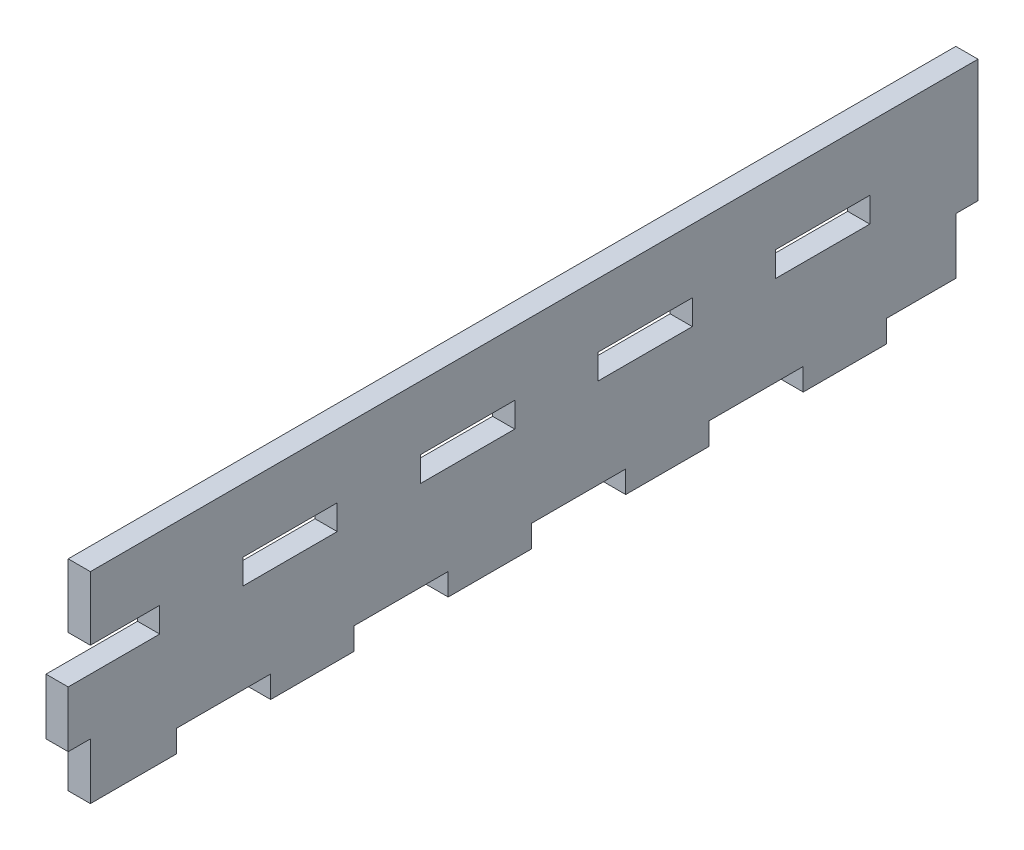
from build123d import *

# Parameters (mm, degrees)
ESQUISSE1_W             = 82
ESQUISSE1_H             = 12.11
BOSS_EXTRU_1_DEPTH      = 2
ESQUISSE2_W             = 8.5
ESQUISSE2_H             = 2.25
ENL_V_MAT_EXTRU_1_DEPTH = 42.581069992
ESQUISSE3_W             = 8.5
ESQUISSE3_H             = 2
ENL_V_MAT_EXTRU_2_DEPTH = 42.581069992
ESQUISSE4_W             = 2
ESQUISSE4_H             = 5.055
ENL_V_MAT_EXTRU_3_DEPTH = 42.581069992
ESQUISSE5_W             = 80
ESQUISSE5_H             = 6
BOSS_EXTRU_2_DEPTH      = 2
ESQUISSE6_W             = 6.25
ESQUISSE6_H             = 0.25
ESQUISSE6_W_2           = 8.5
ENL_V_MAT_EXTRU_4_DEPTH = 43.867766231


with BuildPart() as part:
    # Esquisse1 → Boss.-Extru.1 (new body)
    with BuildSketch(Plane(origin=(0, 0, 0), x_dir=(0, 0, -1), z_dir=(1, 0, 0))):
        with Locations((-0.0892, 0)):
            Rectangle(ESQUISSE1_W, ESQUISSE1_H)
    extrude(amount=BOSS_EXTRU_1_DEPTH)

    # Esquisse2 → Enlèv. mat.-Extru.1 (cut, through all)
    with BuildSketch(Plane(origin=(0, 0, 0), x_dir=(0, 0, -1), z_dir=(1, 0, 0))):
        with Locations((-37.0892, 5.18)):
            Rectangle(ESQUISSE2_W, ESQUISSE2_H)
        with Locations((-21.0892, 5.18)):
            Rectangle(ESQUISSE2_W, ESQUISSE2_H)
        with Locations((-5.0892, 5.18)):
            Rectangle(ESQUISSE2_W, ESQUISSE2_H)
        with Locations((10.9108, 5.18)):
            Rectangle(ESQUISSE2_W, ESQUISSE2_H)
        with Locations((26.9108, 5.18)):
            Rectangle(ESQUISSE2_W, ESQUISSE2_H)
    extrude(amount=ENL_V_MAT_EXTRU_1_DEPTH, mode=Mode.SUBTRACT)

    # Esquisse3 → Enlèv. mat.-Extru.2 (cut, through all)
    with BuildSketch(Plane(origin=(0, 0, 0), x_dir=(0, 0, -1), z_dir=(1, 0, 0))):
        with Locations((-27.0892, -5.055)):
            Rectangle(ESQUISSE3_W, ESQUISSE3_H)
        with Locations((-11.0892, -5.055)):
            Rectangle(ESQUISSE3_W, ESQUISSE3_H)
        with Locations((4.9108, -5.055)):
            Rectangle(ESQUISSE3_W, ESQUISSE3_H)
        with Locations((20.9108, -5.055)):
            Rectangle(ESQUISSE3_W, ESQUISSE3_H)
        with Locations((36.9108, -5.055)):
            Rectangle(ESQUISSE3_W, ESQUISSE3_H)
    extrude(amount=ENL_V_MAT_EXTRU_2_DEPTH, mode=Mode.SUBTRACT)

    # Esquisse4 → Enlèv. mat.-Extru.3 (cut, through all)
    with BuildSketch(Plane(origin=(2, 0, 0), x_dir=(0, 0, -1), z_dir=(1, 0, 0))):
        with Locations((-40.0892, -3.5275)):
            Rectangle(ESQUISSE4_W, ESQUISSE4_H)
        with Locations((39.9108, -1.5275)):
            Rectangle(ESQUISSE4_W, ESQUISSE4_H)
    extrude(amount=-ENL_V_MAT_EXTRU_3_DEPTH, mode=Mode.SUBTRACT)

    # Esquisse5 → Boss.-Extru.2 (add)
    with BuildSketch(Plane.ZY):
        with Locations((-0.9108, 9.055)):
            Rectangle(ESQUISSE5_W, ESQUISSE5_H)
    extrude(amount=-BOSS_EXTRU_2_DEPTH)

    # Esquisse6 → Enlèv. mat.-Extru.4 (cut, through all)
    with BuildSketch(Plane(origin=(2, 0, 0), x_dir=(0, 0, -1), z_dir=(1, 0, 0))):
        with Locations((-35.9642, 6.18)):
            Rectangle(ESQUISSE6_W, ESQUISSE6_H)
        with Locations((-21.0892, 6.18)):
            Rectangle(ESQUISSE6_W_2, ESQUISSE6_H)
        with Locations((-5.0892, 6.18)):
            Rectangle(ESQUISSE6_W_2, ESQUISSE6_H)
        with Locations((10.9108, 6.18)):
            Rectangle(ESQUISSE6_W_2, ESQUISSE6_H)
        with Locations((26.9108, 6.18)):
            Rectangle(ESQUISSE6_W_2, ESQUISSE6_H)
    extrude(amount=-ENL_V_MAT_EXTRU_4_DEPTH, mode=Mode.SUBTRACT)


solid = part.part
